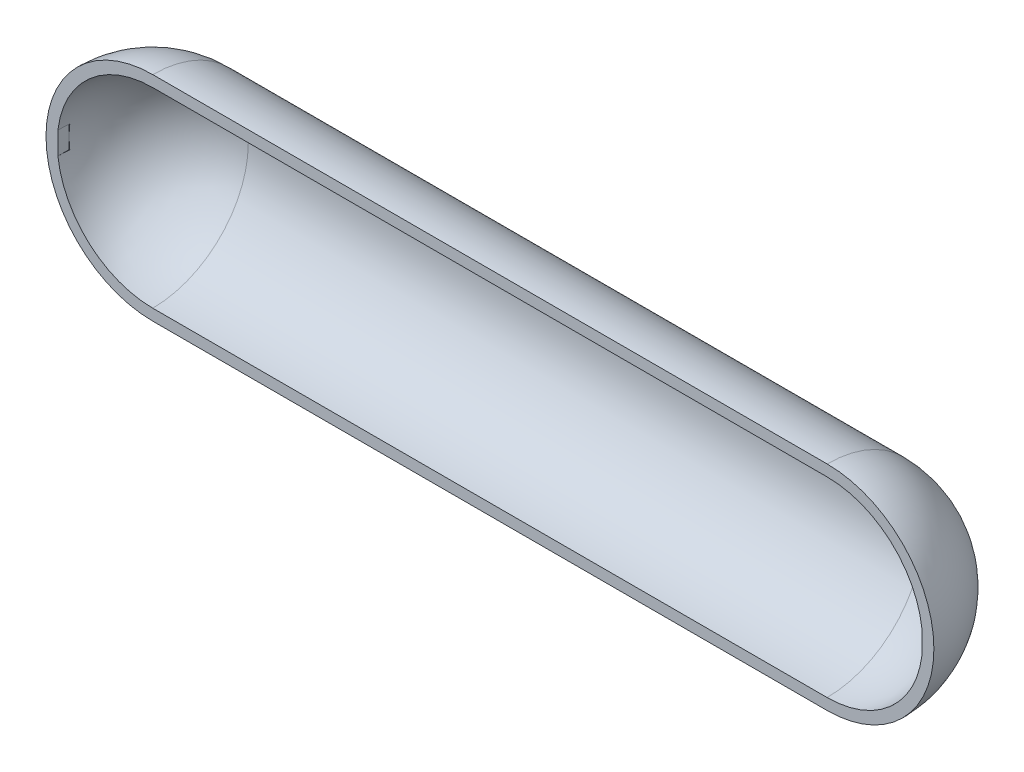
from build123d import *

# Parameters (mm, degrees)
REVOLVE_THIN4_ANGLE = 180
SKETCH3_W           = 7688.194301614
SKETCH3_H           = 200
CUT_EXTRUDE1_DEPTH  = 100


# Read off the part's stored shape, not the designer's step: Revolve-Thin4
with BuildPart() as part:
    # Revolve-Thin4 outline → Revolve-Thin4 (revolve)
    with BuildSketch(Plane(origin=(0, 0, 0), x_dir=(0, -1, 0), z_dir=(0, 0, 1))):
        with BuildLine():
            Line((950, -3000), (950, 3000))
            ThreePointArc((950, 3000), (671.751442127, 3671.751442127), (0, 3950))
            Line((0, 3950), (0, -3950))
            ThreePointArc((0, -3950), (671.751442127, -3671.751442127), (950, -3000))
        make_face()
        with BuildLine():
            Line((850, 3000), (850, -3000))
            ThreePointArc((850, -3000), (635.413251357, -3564.579489532), (100, -3844.097150807))
            Line((100, -3844.097150807), (100, 3844.097150807))
            ThreePointArc((100, 3844.097150807), (635.413251357, 3564.579489532), (850, 3000))
        make_face(mode=Mode.SUBTRACT)
    revolve(axis=Axis((0, 0, 0), (1, 0, 0)), revolution_arc=REVOLVE_THIN4_ANGLE)

    # Sketch3 → Cut-Extrude1 (cut)
    with BuildSketch(Plane.XY):
        Rectangle(SKETCH3_W, SKETCH3_H)
    extrude(amount=-CUT_EXTRUDE1_DEPTH, mode=Mode.SUBTRACT)


solid = part.part
